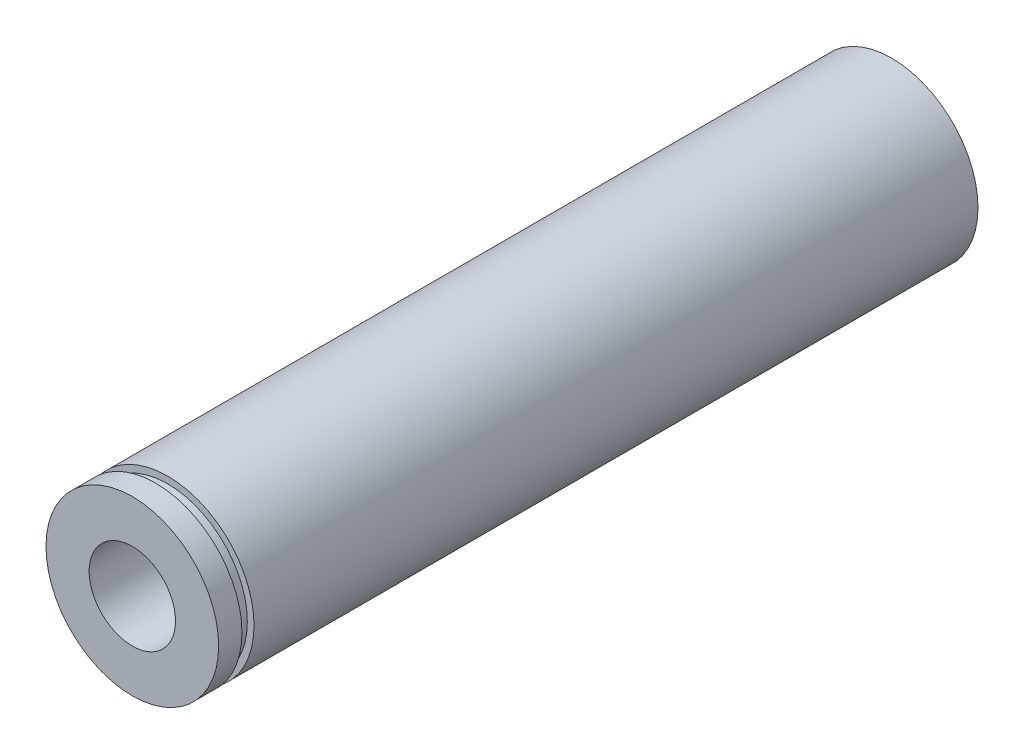
from build123d import *

# Parameters (mm, degrees)
SKETCH1_R           = 6.35
SKETCH1_R_2         = 3.175
BOSS_EXTRUDE1_DEPTH = 27.9273
SKETCH2_W           = 0.889
SKETCH2_H           = 1.0033


with BuildPart() as part:
    # Sketch1 → Boss-Extrude1 (new, symmetric)
    with BuildSketch(Plane.XY):
        Circle(SKETCH1_R)
        Circle(SKETCH1_R_2, mode=Mode.SUBTRACT)
    extrude(amount=BOSS_EXTRUDE1_DEPTH, both=True)

    # Sketch2 → Cut-Revolve1 (revolve, cut)
    with BuildSketch(Plane(origin=(0, 0, 0), x_dir=(0, 0, -1), z_dir=(1, 0, 0))):
        with Locations((-25.7683, 6.35635)):
            Rectangle(SKETCH2_W, SKETCH2_H)
    revolve(axis=Axis((0, 0, 2.405637885), (0, 0, -1)), mode=Mode.SUBTRACT)


solid = part.part
